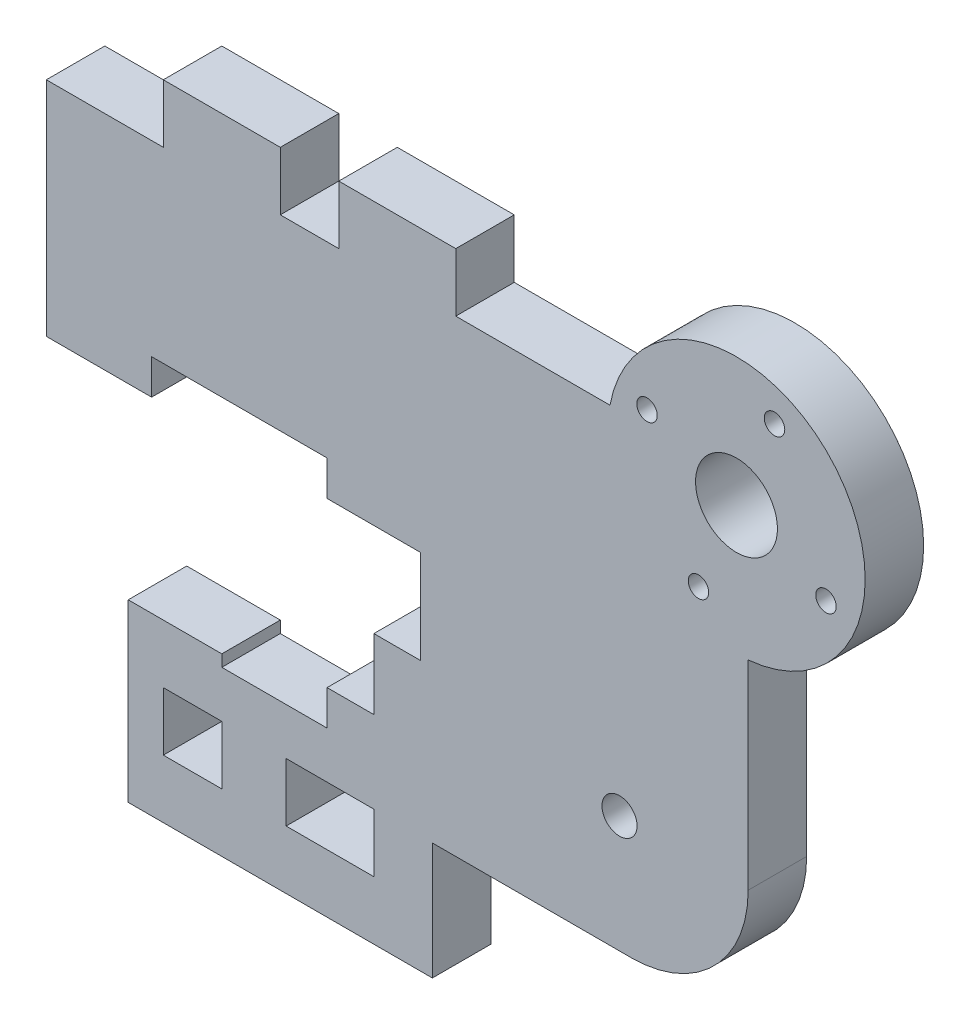
from build123d import *

# Parameters (mm, degrees)
ESQUISSE1_W        = 5
ESQUISSE1_H        = 5
ESQUISSE1_W_2      = 7.5
ESQUISSE1_R        = 1.5
ESQUISSE1_R_2      = 0.875
ESQUISSE1_R_3      = 3.5
BOSS_EXTRU_1_DEPTH = 5
CONG_1_R           = 10


with BuildPart() as part:
    # Esquisse1 → Boss.-Extru.1 (new body)
    with BuildSketch(Plane.XY):
        with BuildLine():
            Line((-8, 5), (-8, -10))
            Line((-8, -10), (18, -10))
            Line((18, -10), (18, 0))
            Line((18, 0), (45, 0))
            Line((45, 0), (45, 27.04554885))
            ThreePointArc((45, 27.04554885), (52.126876659, 45.413088139), (33.183346174, 40))
            Line((33.183346174, 40), (20, 40))
            Line((20, 40), (20, 45))
            Line((20, 45), (10, 45))
            Line((10, 45), (10, 40))
            Line((10, 40), (5, 40))
            Line((5, 40), (5, 45))
            Line((5, 45), (-5, 45))
            Line((-5, 45), (-5, 40))
            Line((-5, 40), (-15, 40))
            Line((-15, 40), (-15, 21))
            Line((-15, 21), (-6, 21))
            Line((-6, 21), (-6, 24))
            Line((-6, 24), (9, 24))
            Line((9, 24), (9, 21))
            Line((9, 21), (17, 21))
            Line((17, 21), (17, 13))
            Line((17, 13), (13, 13))
            Line((13, 13), (13, 7))
            Line((13, 7), (9, 7))
            Line((9, 7), (9, 4))
            Line((9, 4), (0, 4))
            Line((0, 4), (0, 5))
            Line((0, 5), (-8, 5))
        make_face()
        with Locations((-2.5, -2.5)):
            Rectangle(ESQUISSE1_W, ESQUISSE1_H, mode=Mode.SUBTRACT)
        with Locations((9.25, -2.5)):
            Rectangle(ESQUISSE1_W_2, ESQUISSE1_H, mode=Mode.SUBTRACT)
        with Locations((34, 10)):
            Circle(ESQUISSE1_R, mode=Mode.SUBTRACT)
        with Locations((40.75, 30.35)):
            Circle(ESQUISSE1_R_2, mode=Mode.SUBTRACT)
        with Locations((36.35, 41.25)):
            Circle(ESQUISSE1_R_2, mode=Mode.SUBTRACT)
        with Locations((44, 38)):
            Circle(ESQUISSE1_R_3, mode=Mode.SUBTRACT)
        with Locations((51.65, 34.75)):
            Circle(ESQUISSE1_R_2, mode=Mode.SUBTRACT)
        with Locations((47.25, 45.65)):
            Circle(ESQUISSE1_R_2, mode=Mode.SUBTRACT)
    extrude(amount=BOSS_EXTRU_1_DEPTH)

    # Congé1
    cong_1_edges = [part.edges().sort_by_distance(p)[0] for p in [
        (45, 0, 2.5),
    ]]
    fillet(cong_1_edges, radius=CONG_1_R)


solid = part.part
